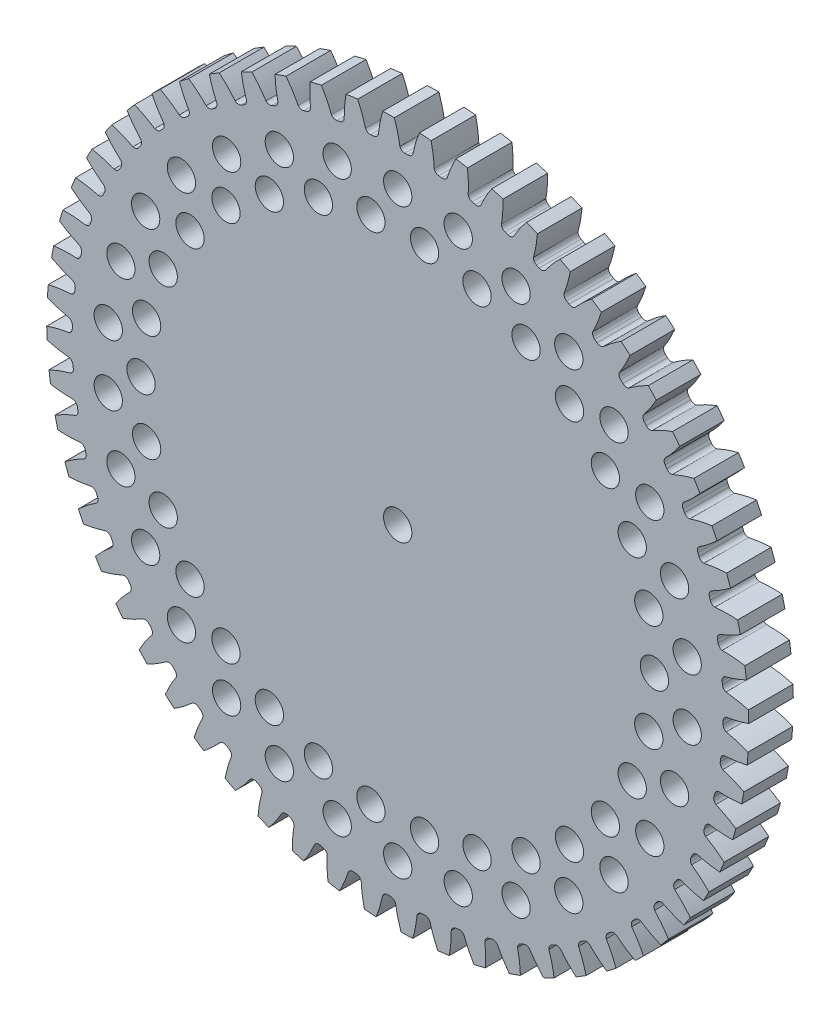
from build123d import *

# Parameters (mm, degrees)
SKETCH1_R           = 39.37
BOSS_EXTRUDE1_DEPTH = 5
CUT_EXTRUDE1_DEPTH  = 56.901643983
FILLET1_R           = 0.5984748
CIRPATTERN1_START   = -5
CIRPATTERN1_DEPTH   = 5
SKETCH5_R           = 1.5875
CUT_EXTRUDE2_DEPTH  = 56.899150665
SKETCH6_R           = 1.5875
CUT_EXTRUDE3_DEPTH  = 56.899150665


# Read off the part's stored shape, not the designer's step: CirPattern1
with BuildPart() as part:
    # Sketch1 → Boss-Extrude1 (new body)
    with BuildSketch(Plane.XY):
        Circle(SKETCH1_R)
    extrude(amount=-BOSS_EXTRUDE1_DEPTH)

    # Sketch4 → Cut-Extrude1 (cut, through all)
    with BuildSketch(Plane.XY):
        with BuildLine():
            Line((0.240086699, 36.885643751), (0.240086699, 36.511710651))
            ThreePointArc((0.240086699, 36.511710651), (0.95578806, 36.49998802), (1.671122089, 36.474237582))
            Line((1.671122089, 36.474237582), (1.690692281, 36.847658218))
            add(Edge.make_bspline(
                [(6.096951349, 44.559283342), (2.598097025, 41.225389562), (1.690692281, 36.847658218)],
                knots=[0, 0, 0, 1, 1, 1], degree=2))
            ThreePointArc((6.096951349, 44.559283342), (1.177297011, 44.959053809), (-3.756537499, 44.817306632))
            add(Edge.make_bspline(
                [(-3.756537499, 44.817306632), (-0.436961182, 41.304865544), (0.240086699, 36.885643751)],
                knots=[0, 0, 0, 1, 1, 1], degree=2))
        make_face()
    extrude(amount=-CUT_EXTRUDE1_DEPTH, mode=Mode.SUBTRACT)

    # Fillet1
    # the kernel refuses this fillet: 0.5984748 mm, written as the material it adds along each edge
    with BuildSketch(Plane(origin=(1.671122089, 36.474237582, 0), x_dir=(-0.999265847905185, 0.038311424018578885, 0), z_dir=(0, 0, -1))) as fillet1_piece_1:
        with BuildLine():
            CenterArc((0.549497284, 0.598458131), FILLET1_R, 202.038134549, 67.534227831)
            Line((-0.005249548, 0.37389625), (-0.016344485, 0.369405012))
            ThreePointArc((-0.016344485, 0.369405012), (-0.014593091, 0.186780088), (-0.011968316, -0.000168037))
            Line((-0.011968316, -0.000168037), (8.9336e-05, -0.011969163))
            ThreePointArc((8.9336e-05, -0.011969163), (0.272515249, -0.010952507), (0.544941163, -0.011969163))
            Line((0.544941163, -0.011969163), (0.545030498, 0))
        make_face()
    extrude(amount=5)
    with BuildSketch(Plane(origin=(0.240086699, 36.511710651, 0), x_dir=(0, 1, 0), z_dir=(0, 0, -1))) as fillet1_piece_2:
        with BuildLine():
            CenterArc((0.590684906, 0.557844728), FILLET1_R, 181.232024399, 67.534227831)
            Line((-0.00765154, 0.544976787), (-0.019618269, 0.544719428))
            ThreePointArc((-0.019618269, 0.544719428), (-0.014777198, 0.272334634), (-0.011969237, -7.8705e-05))
            Line((-0.011969237, -7.8705e-05), (0, -0.011969496))
            ThreePointArc((0, -0.011969496), (0.18696655, -0.011969496), (0.369598064, -0.011156895))
            Line((0.369598064, -0.011156895), (0.3739331, 0))
        make_face()
    extrude(amount=5)

    # CirPattern1 outline → CirPattern1 (cut)
    with BuildSketch(Plane.XY.offset(CIRPATTERN1_START)):
        with BuildLine():
            ThreePointArc((-1.68753641, 39.333816505), (-3.088932196, 39.248635618), (-4.486399717, 39.113541359))
            add(Edge.make_bspline(
                [(-4.486399717, 39.113541359), (-3.945469906, 37.960468416), (-3.616828179, 36.708676229)],
                knots=[0.71051755, 0.71051755, 0.71051755, 1, 1, 1], degree=2))
            ThreePointArc((-3.616828179, 36.708676229), (-3.374834584, 36.45910908), (-3.034950376, 36.386147535))
            ThreePointArc((-3.034950376, 36.386147535), (-2.864735504, 36.399944323), (-2.694457965, 36.412944848))
            ThreePointArc((-2.694457965, 36.412944848), (-2.370171981, 36.53817768), (-2.170198597, 36.822528357))
            add(Edge.make_bspline(
                [(-2.170198597, 36.822528357), (-2.041426278, 38.110319782), (-1.68753641, 39.333816505)],
                knots=[0, 0, 0, 0.28948245, 0.28948245, 0.28948245], degree=2))
        make_face()
        with BuildLine():
            add(Edge.make_bspline(
                [(5.53305958, 36.469077425), (5.926764807, 37.701954247), (6.527300605, 38.825136791)],
                knots=[0, 0, 0, 0.28948245, 0.28948245, 0.28948245], degree=2))
            ThreePointArc((6.527300605, 38.825136791), (5.138818577, 39.033183877), (3.743801398, 39.191591586))
            add(Edge.make_bspline(
                [(3.743801398, 39.191591586), (4.03317325, 37.951250423), (4.094371136, 36.658484441)],
                knots=[0.71051755, 0.71051755, 0.71051755, 1, 1, 1], degree=2))
            ThreePointArc((4.094371136, 36.658484441), (4.279188663, 36.364057636), (4.596476027, 36.222024576))
            ThreePointArc((4.596476027, 36.222024576), (4.765839809, 36.200130209), (4.935099337, 36.17744395))
            ThreePointArc((4.935099337, 36.17744395), (5.278336265, 36.232517296), (5.53305958, 36.469077425))
        make_face()
        with BuildLine():
            add(Edge.make_bspline(
                [(9.314805521, 35.690933788), (9.835224709, 36.87590338), (10.549875254, 37.930159927)],
                knots=[0, 0, 0, 0.28948245, 0.28948245, 0.28948245], degree=2))
            ThreePointArc((10.549875254, 37.930159927), (9.190746318, 38.282203202), (7.819929304, 38.585562139))
            add(Edge.make_bspline(
                [(7.819929304, 38.585562139), (7.978064991, 37.321768101), (7.903796787, 36.029687105)],
                knots=[0.71051755, 0.71051755, 0.71051755, 1, 1, 1], degree=2))
            ThreePointArc((7.903796787, 36.029687105), (8.056825882, 35.717554508), (8.357528616, 35.54313396))
            ThreePointArc((8.357528616, 35.54313396), (8.523676021, 35.503656197), (8.689636968, 35.463401777))
            ThreePointArc((8.689636968, 35.463401777), (9.03675034, 35.482295397), (9.314805521, 35.690933788))
        make_face()
        with BuildLine():
            add(Edge.make_bspline(
                [(12.994496503, 34.521752811), (13.635927831, 35.645832398), (14.456863262, 36.619612295)],
                knots=[0, 0, 0, 0.28948245, 0.28948245, 0.28948245], degree=2))
            ThreePointArc((14.456863262, 36.619612295), (13.141978319, 37.111794698), (11.810380428, 37.556781199))
            add(Edge.make_bspline(
                [(11.810380428, 37.556781199), (11.835547382, 36.283380677), (11.626626787, 35.006140977)],
                knots=[0.71051755, 0.71051755, 0.71051755, 1, 1, 1], degree=2))
            ThreePointArc((11.626626787, 35.006140977), (11.746190832, 34.679722379), (12.027014372, 34.47482533))
            ThreePointArc((12.027014372, 34.47482533), (12.188125054, 34.418196697), (12.348969117, 34.360815153))
            ThreePointArc((12.348969117, 34.360815153), (12.696155887, 34.343322045), (12.994496503, 34.521752811))
        make_face()
        with BuildLine():
            add(Edge.make_bspline(
                [(16.531817062, 32.974344287), (17.287232874, 34.025218217), (18.205458851, 34.907852526)],
                knots=[0, 0, 0, 0.28948245, 0.28948245, 0.28948245], degree=2))
            ThreePointArc((18.205458851, 34.907852526), (16.949224056, 35.534781605), (15.671434552, 36.116520305))
            add(Edge.make_bspline(
                [(15.671434552, 36.116520305), (15.563357039, 34.847464941), (15.22207303, 33.599060243)],
                knots=[0.71051755, 0.71051755, 0.71051755, 1, 1, 1], degree=2))
            ThreePointArc((15.22207303, 33.599060243), (15.306862056, 33.261931955), (15.564729642, 33.0288033))
            ThreePointArc((15.564729642, 33.0288033), (15.71903844, 32.955644233), (15.873003377, 32.881764248))
            ThreePointArc((15.873003377, 32.881764248), (16.216459693, 32.828076069), (16.531817062, 32.974344287))
        make_face()
        with BuildLine():
            add(Edge.make_bspline(
                [(19.888011574, 31.065661946), (20.749135376, 32.031816625), (21.754591623, 32.813635021)],
                knots=[0, 0, 0, 0.28948245, 0.28948245, 0.28948245], degree=2))
            ThreePointArc((21.754591623, 32.813635021), (20.570770546, 33.568442009), (19.360789159, 34.280559256))
            add(Edge.make_bspline(
                [(19.360789159, 34.280559256), (19.1206513, 33.029753087), (18.650743055, 31.823861174)],
                knots=[0.71051755, 0.71051755, 0.71051755, 1, 1, 1], degree=2))
            ThreePointArc((18.650743055, 31.823861174), (18.699828097, 31.479716843), (18.931914477, 31.220910789))
            ThreePointArc((18.931914477, 31.220910789), (19.07773075, 31.132022833), (19.22312969, 31.042453852))
            ThreePointArc((19.22312969, 31.042453852), (19.559092574, 30.953158822), (19.888011574, 31.065661946))
        make_face()
        with BuildLine():
            add(Edge.make_bspline(
                [(23.02630887, 28.816617712), (23.983706009, 29.687467747), (25.065376537, 30.359904464)],
                knots=[0, 0, 0, 0.28948245, 0.28948245, 0.28948245], degree=2))
            ThreePointArc((25.065376537, 30.359904464), (23.96693937, 31.234319537), (22.838022909, 32.069013227))
            add(Edge.make_bspline(
                [(22.838022909, 32.069013227), (22.468455704, 30.850160347), (21.875071637, 29.699993222)],
                knots=[0.71051755, 0.71051755, 0.71051755, 1, 1, 1], degree=2))
            ThreePointArc((21.875071637, 29.699993222), (21.887914908, 29.352603366), (22.091677296, 29.070955446))
            ThreePointArc((22.091677296, 29.070955446), (22.22740345, 28.967312477), (22.362643371, 28.863035836))
            ThreePointArc((22.362643371, 28.863035836), (22.687431943, 28.739112289), (23.02630887, 28.816617712))
        make_face()
        with BuildLine():
            add(Edge.make_bspline(
                [(25.912325106, 26.251852585), (26.95550614, 27.01785676), (28.101539941, 27.57354444)],
                knots=[0, 0, 0, 0.28948245, 0.28948245, 0.28948245], degree=2))
            ThreePointArc((28.101539941, 27.57354444), (27.100521391, 28.557987325), (26.065038501, 29.506112378))
            add(Edge.make_bspline(
                [(26.065038501, 29.506112378), (25.570091005, 28.332566794), (24.859732357, 27.25072593)],
                knots=[0.71051755, 0.71051755, 0.71051755, 1, 1, 1], degree=2))
            ThreePointArc((24.859732357, 27.25072593), (24.836193142, 26.903896624), (25.009399074, 26.602492631))
            ThreePointArc((25.009399074, 26.602492631), (25.133548066, 26.485230183), (25.257147252, 26.36738836))
            ThreePointArc((25.257147252, 26.36738836), (25.56720306, 26.210194029), (25.912325106, 26.251852585))
        make_face()
        with BuildLine():
            add(Edge.make_bspline(
                [(28.514440487, 23.399466666), (29.631976105, 24.05223248), (30.829816992, 24.485082893)],
                knots=[0, 0, 0, 0.28948245, 0.28948245, 0.28948245], degree=2))
            ThreePointArc((30.829816992, 24.485082893), (29.937184428, 25.568767827), (29.006480076, 26.619936387))
            add(Edge.make_bspline(
                [(29.006480076, 26.619936387), (28.391575039, 25.50455571), (27.572024646, 24.502893981)],
                knots=[0.71051755, 0.71051755, 0.71051755, 1, 1, 1], degree=2))
            ThreePointArc((27.572024646, 24.502893981), (27.512360848, 24.160425161), (27.653112643, 23.842567341))
            ThreePointArc((27.653112643, 23.842567341), (27.764324271, 23.712970165), (27.874928543, 23.582854259))
            ThreePointArc((27.874928543, 23.582854259), (28.166854551, 23.394111398), (28.514440487, 23.399466666))
        make_face()
        with BuildLine():
            add(Edge.make_bspline(
                [(30.80414569, 20.290711295), (31.983791939, 20.823086908), (33.220316116, 21.128357654)],
                knots=[0, 0, 0, 0.28948245, 0.28948245, 0.28948245], degree=2))
            ThreePointArc((33.220316116, 21.128357654), (32.445849407, 22.299411559), (31.630120586, 23.442106803))
            add(Edge.make_bspline(
                [(31.630120586, 23.442106803), (30.901995035, 22.397111377), (29.982232064, 21.486603199)],
                knots=[0.71051755, 0.71051755, 0.71051755, 1, 1, 1], degree=2))
            ThreePointArc((29.982232064, 21.486603199), (29.88709737, 21.152247024), (29.993852923, 20.821417893))
            ThreePointArc((29.993852923, 20.821417893), (30.090908728, 20.680905884), (30.187306283, 20.539941471))
            ThreePointArc((30.187306283, 20.539941471), (30.457904088, 20.321717986), (30.80414569, 20.290711295))
        make_face()
        with BuildLine():
            add(Edge.make_bspline(
                [(32.756354227, 16.959646644), (33.985186655, 17.365799239), (35.246846505, 17.540145707)],
                knots=[0, 0, 0, 0.28948245, 0.28948245, 0.28948245], degree=2))
            ThreePointArc((35.246846505, 17.540145707), (34.599030871, 18.785738271), (33.907214876, 20.007440591))
            add(Edge.make_bspline(
                [(33.907214876, 20.007440591), (33.073846306, 19.044279604), (32.063947872, 18.234900695)],
                knots=[0.71051755, 0.71051755, 0.71051755, 1, 1, 1], degree=2))
            ThreePointArc((32.063947872, 18.234900695), (31.9343846, 17.912320441), (32.005974274, 17.572144634))
            ThreePointArc((32.005974274, 17.572144634), (32.087810893, 17.42225727), (32.168945578, 17.271988787))
            ThreePointArc((32.168945578, 17.271988787), (32.415250455, 17.02667558), (32.756354227, 16.959646644))
        make_face()
        with BuildLine():
            add(Edge.make_bspline(
                [(34.349677293, 13.442768555), (35.614232554, 13.718248238), (36.887205069, 13.759760253)],
                knots=[0, 0, 0, 0.28948245, 0.28948245, 0.28948245], degree=2))
            ThreePointArc((36.887205069, 13.759760253), (36.373138113, 15.066244504), (35.812814623, 16.353568673))
            add(Edge.make_bspline(
                [(35.812814623, 16.353568673), (34.883333597, 15.482794719), (33.794364359, 14.783412804)],
                knots=[0.71051755, 0.71051755, 0.71051755, 1, 1, 1], degree=2))
            ThreePointArc((33.794364359, 14.783412804), (33.631792029, 14.476142728), (33.667431473, 14.13034728))
            ThreePointArc((33.667431473, 14.13034728), (33.733152286, 13.972726759), (33.798135174, 13.814800579))
            ThreePointArc((33.798135174, 13.814800579), (34.017448554, 13.545085353), (34.349677293, 13.442768555))
        make_face()
        with BuildLine():
            add(Edge.make_bspline(
                [(35.566658106, 9.778608681), (36.853081469, 9.92039724), (38.123419694, 9.828619987)],
                knots=[0, 0, 0, 0.28948245, 0.28948245, 0.28948245], degree=2))
            ThreePointArc((38.123419694, 9.828619987), (37.748733641, 11.181681809), (37.32604168, 12.520523635))
            add(Edge.make_bspline(
                [(37.32604168, 12.520523635), (36.310631785, 11.751677095), (35.154522717, 11.169954748)],
                knots=[0.71051755, 0.71051755, 0.71051755, 1, 1, 1], degree=2))
            ThreePointArc((35.154522717, 11.169954748), (34.960722507, 10.881361366), (34.960021247, 10.533734885))
            ThreePointArc((34.960021247, 10.533734885), (35.008906204, 10.37010813), (35.057025328, 10.206254525))
            ThreePointArc((35.057025328, 10.206254525), (35.246944369, 9.915092336), (35.566658106, 9.778608681))
        make_face()
        with BuildLine():
            add(Edge.make_bspline(
                [(36.393963169, 6.007312325), (37.688160311, 6.013856293), (38.941946155, 5.789795303)],
                knots=[0, 0, 0, 0.28948245, 0.28948245, 0.28948245], degree=2))
            ThreePointArc((38.941946155, 5.789795303), (38.710746145, 7.174610268), (38.430316813, 8.55030112))
            add(Edge.make_bspline(
                [(38.430316813, 8.55030112), (37.340103092, 7.891805638), (36.129520768, 7.434116331)],
                knots=[0.71051755, 0.71051755, 0.71051755, 1, 1, 1], degree=2))
            ThreePointArc((36.129520768, 7.434116331), (35.906615993, 7.167361532), (35.869581713, 6.821712687))
            ThreePointArc((35.869581713, 6.821712687), (35.90109522, 6.653872427), (35.931823376, 6.48588661))
            ThreePointArc((35.931823376, 6.48588661), (36.090267284, 6.176467494), (36.393963169, 6.007312325))
        make_face()
        with BuildLine():
            add(Edge.make_bspline(
                [(36.822528357, 2.170198597), (38.110319782, 2.041426278), (39.333816505, 1.68753641)],
                knots=[0, 0, 0, 0.28948245, 0.28948245, 0.28948245], degree=2))
            ThreePointArc((39.333816505, 1.68753641), (39.248635613, 3.088932196), (39.113541353, 4.486399716))
            add(Edge.make_bspline(
                [(39.113541353, 4.486399716), (37.960468416, 3.945469906), (36.708676229, 3.616828179)],
                knots=[0.71051755, 0.71051755, 0.71051755, 1, 1, 1], degree=2))
            ThreePointArc((36.708676229, 3.616828179), (36.45910908, 3.374834584), (36.386147535, 3.034950376))
            ThreePointArc((36.386147535, 3.034950376), (36.399944323, 2.864735504), (36.412944848, 2.694457965))
            ThreePointArc((36.412944848, 2.694457965), (36.53817768, 2.370171981), (36.822528357, 2.170198597))
        make_face()
        with BuildLine():
            add(Edge.make_bspline(
                [(36.847658218, -1.690692281), (38.114934615, -1.95337003), (39.29473733, -2.433211484)],
                knots=[0, 0, 0, 0.28948245, 0.28948245, 0.28948245], degree=2))
            ThreePointArc((39.29473733, -2.433211484), (39.356508816, -1.030588864), (39.368229749, 0.373344379))
            add(Edge.make_bspline(
                [(39.368229749, 0.373344379), (38.164930905, -0.044093219), (36.885643751, -0.240086699)],
                knots=[0.71051755, 0.71051755, 0.71051755, 1, 1, 1], degree=2))
            ThreePointArc((36.885643751, -0.240086699), (36.612148538, -0.454667757), (36.504059111, -0.785063485))
            ThreePointArc((36.504059111, -0.785063485), (36.49998802, -0.95578806), (36.495118477, -1.126491726))
            ThreePointArc((36.495118477, -1.126491726), (36.585768154, -1.462091633), (36.847658218, -1.690692281))
        make_face()
        with BuildLine():
            add(Edge.make_bspline(
                [(36.469077425, -5.53305958), (37.701954247, -5.926764807), (38.825136791, -6.527300605)],
                knots=[0, 0, 0, 0.28948245, 0.28948245, 0.28948245], degree=2))
            ThreePointArc((38.825136791, -6.527300605), (39.033183872, -5.138818577), (39.191591581, -3.743801398))
            add(Edge.make_bspline(
                [(39.191591581, -3.743801398), (37.951250423, -4.03317325), (36.658484441, -4.094371136)],
                knots=[0.71051755, 0.71051755, 0.71051755, 1, 1, 1], degree=2))
            ThreePointArc((36.658484441, -4.094371136), (36.364057636, -4.279188663), (36.222024576, -4.596476027))
            ThreePointArc((36.222024576, -4.596476027), (36.200130209, -4.765839809), (36.17744395, -4.935099337))
            ThreePointArc((36.17744395, -4.935099337), (36.232517296, -5.278336265), (36.469077425, -5.53305958))
        make_face()
        with BuildLine():
            add(Edge.make_bspline(
                [(35.690933788, -9.314805521), (36.87590338, -9.835224709), (37.930159927, -10.549875254)],
                knots=[0, 0, 0, 0.28948245, 0.28948245, 0.28948245], degree=2))
            ThreePointArc((37.930159927, -10.549875254), (38.282203198, -9.190746317), (38.585562135, -7.819929303))
            add(Edge.make_bspline(
                [(38.585562135, -7.819929303), (37.321768101, -7.978064991), (36.029687105, -7.903796787)],
                knots=[0.71051755, 0.71051755, 0.71051755, 1, 1, 1], degree=2))
            ThreePointArc((36.029687105, -7.903796787), (35.717554508, -8.056825882), (35.54313396, -8.357528616))
            ThreePointArc((35.54313396, -8.357528616), (35.503656197, -8.523676021), (35.463401777, -8.689636968))
            ThreePointArc((35.463401777, -8.689636968), (35.482295397, -9.03675034), (35.690933788, -9.314805521))
        make_face()
        with BuildLine():
            add(Edge.make_bspline(
                [(34.521752811, -12.994496503), (35.645832398, -13.635927831), (36.619612295, -14.456863262)],
                knots=[0, 0, 0, 0.28948245, 0.28948245, 0.28948245], degree=2))
            ThreePointArc((36.619612295, -14.456863262), (37.111794695, -13.141978318), (37.556781195, -11.810380427))
            add(Edge.make_bspline(
                [(37.556781195, -11.810380427), (36.283380677, -11.835547382), (35.006140977, -11.626626787)],
                knots=[0.71051755, 0.71051755, 0.71051755, 1, 1, 1], degree=2))
            ThreePointArc((35.006140977, -11.626626787), (34.679722379, -11.746190832), (34.47482533, -12.027014372))
            ThreePointArc((34.47482533, -12.027014372), (34.418196697, -12.188125054), (34.360815153, -12.348969117))
            ThreePointArc((34.360815153, -12.348969117), (34.343322045, -12.696155887), (34.521752811, -12.994496503))
        make_face()
        with BuildLine():
            add(Edge.make_bspline(
                [(32.974344287, -16.531817062), (34.025218217, -17.287232874), (34.907852526, -18.205458851)],
                knots=[0, 0, 0, 0.28948245, 0.28948245, 0.28948245], degree=2))
            ThreePointArc((34.907852526, -18.205458851), (35.534781603, -16.949224055), (36.116520302, -15.671434551))
            add(Edge.make_bspline(
                [(36.116520302, -15.671434551), (34.847464941, -15.563357039), (33.599060243, -15.22207303)],
                knots=[0.71051755, 0.71051755, 0.71051755, 1, 1, 1], degree=2))
            ThreePointArc((33.599060243, -15.22207303), (33.261931955, -15.306862056), (33.0288033, -15.564729642))
            ThreePointArc((33.0288033, -15.564729642), (32.955644233, -15.71903844), (32.881764248, -15.873003377))
            ThreePointArc((32.881764248, -15.873003377), (32.828076069, -16.216459693), (32.974344287, -16.531817062))
        make_face()
        with BuildLine():
            add(Edge.make_bspline(
                [(31.065661946, -19.888011574), (32.031816625, -20.749135376), (32.813635021, -21.754591623)],
                knots=[0, 0, 0, 0.28948245, 0.28948245, 0.28948245], degree=2))
            ThreePointArc((32.813635021, -21.754591623), (33.568442007, -20.570770545), (34.280559254, -19.360789158))
            add(Edge.make_bspline(
                [(34.280559254, -19.360789158), (33.029753087, -19.1206513), (31.823861174, -18.650743055)],
                knots=[0.71051755, 0.71051755, 0.71051755, 1, 1, 1], degree=2))
            ThreePointArc((31.823861174, -18.650743055), (31.479716843, -18.699828097), (31.220910789, -18.931914477))
            ThreePointArc((31.220910789, -18.931914477), (31.132022833, -19.07773075), (31.042453852, -19.22312969))
            ThreePointArc((31.042453852, -19.22312969), (30.953158822, -19.559092574), (31.065661946, -19.888011574))
        make_face()
        with BuildLine():
            add(Edge.make_bspline(
                [(28.816617712, -23.02630887), (29.687467747, -23.983706009), (30.359904464, -25.065376537)],
                knots=[0, 0, 0, 0.28948245, 0.28948245, 0.28948245], degree=2))
            ThreePointArc((30.359904464, -25.065376537), (31.234319536, -23.96693937), (32.069013226, -22.838022908))
            add(Edge.make_bspline(
                [(32.069013226, -22.838022908), (30.850160347, -22.468455704), (29.699993222, -21.875071637)],
                knots=[0.71051755, 0.71051755, 0.71051755, 1, 1, 1], degree=2))
            ThreePointArc((29.699993222, -21.875071637), (29.352603366, -21.887914908), (29.070955446, -22.091677296))
            ThreePointArc((29.070955446, -22.091677296), (28.967312477, -22.22740345), (28.863035836, -22.362643371))
            ThreePointArc((28.863035836, -22.362643371), (28.739112289, -22.687431943), (28.816617712, -23.02630887))
        make_face()
        with BuildLine():
            add(Edge.make_bspline(
                [(26.251852585, -25.912325106), (27.01785676, -26.95550614), (27.57354444, -28.101539941)],
                knots=[0, 0, 0, 0.28948245, 0.28948245, 0.28948245], degree=2))
            ThreePointArc((27.57354444, -28.101539941), (28.557987325, -27.100521391), (29.506112377, -26.065038501))
            add(Edge.make_bspline(
                [(29.506112377, -26.065038501), (28.332566794, -25.570091005), (27.25072593, -24.859732357)],
                knots=[0.71051755, 0.71051755, 0.71051755, 1, 1, 1], degree=2))
            ThreePointArc((27.25072593, -24.859732357), (26.903896624, -24.836193142), (26.602492631, -25.009399074))
            ThreePointArc((26.602492631, -25.009399074), (26.485230183, -25.133548066), (26.36738836, -25.257147252))
            ThreePointArc((26.36738836, -25.257147252), (26.210194029, -25.56720306), (26.251852585, -25.912325106))
        make_face()
        with BuildLine():
            add(Edge.make_bspline(
                [(23.399466666, -28.514440487), (24.05223248, -29.631976105), (24.485082893, -30.829816992)],
                knots=[0, 0, 0, 0.28948245, 0.28948245, 0.28948245], degree=2))
            ThreePointArc((24.485082893, -30.829816992), (25.568767828, -29.937184428), (26.619936387, -29.006480077))
            add(Edge.make_bspline(
                [(26.619936387, -29.006480077), (25.50455571, -28.391575039), (24.502893981, -27.572024646)],
                knots=[0.71051755, 0.71051755, 0.71051755, 1, 1, 1], degree=2))
            ThreePointArc((24.502893981, -27.572024646), (24.160425161, -27.512360848), (23.842567341, -27.653112643))
            ThreePointArc((23.842567341, -27.653112643), (23.712970165, -27.764324271), (23.582854259, -27.874928543))
            ThreePointArc((23.582854259, -27.874928543), (23.394111398, -28.166854551), (23.399466666, -28.514440487))
        make_face()
        with BuildLine():
            add(Edge.make_bspline(
                [(20.290711295, -30.80414569), (20.823086908, -31.983791939), (21.128357654, -33.220316116)],
                knots=[0, 0, 0, 0.28948245, 0.28948245, 0.28948245], degree=2))
            ThreePointArc((21.128357654, -33.220316116), (22.29941156, -32.445849409), (23.442106804, -31.630120587))
            add(Edge.make_bspline(
                [(23.442106804, -31.630120587), (22.397111377, -30.901995035), (21.486603199, -29.982232064)],
                knots=[0.71051755, 0.71051755, 0.71051755, 1, 1, 1], degree=2))
            ThreePointArc((21.486603199, -29.982232064), (21.152247024, -29.88709737), (20.821417893, -29.993852923))
            ThreePointArc((20.821417893, -29.993852923), (20.680905884, -30.090908728), (20.539941471, -30.187306283))
            ThreePointArc((20.539941471, -30.187306283), (20.321717986, -30.457904088), (20.290711295, -30.80414569))
        make_face()
        with BuildLine():
            add(Edge.make_bspline(
                [(16.959646644, -32.756354227), (17.365799239, -33.985186655), (17.540145707, -35.246846505)],
                knots=[0, 0, 0, 0.28948245, 0.28948245, 0.28948245], degree=2))
            ThreePointArc((17.540145707, -35.246846505), (18.785738272, -34.599030873), (20.007440592, -33.907214877))
            add(Edge.make_bspline(
                [(20.007440592, -33.907214877), (19.044279604, -33.073846306), (18.234900695, -32.063947872)],
                knots=[0.71051755, 0.71051755, 0.71051755, 1, 1, 1], degree=2))
            ThreePointArc((18.234900695, -32.063947872), (17.912320441, -31.9343846), (17.572144634, -32.005974274))
            ThreePointArc((17.572144634, -32.005974274), (17.42225727, -32.087810893), (17.271988787, -32.168945578))
            ThreePointArc((17.271988787, -32.168945578), (17.02667558, -32.415250455), (16.959646644, -32.756354227))
        make_face()
        with BuildLine():
            add(Edge.make_bspline(
                [(13.442768555, -34.349677293), (13.718248238, -35.614232554), (13.759760253, -36.887205069)],
                knots=[0, 0, 0, 0.28948245, 0.28948245, 0.28948245], degree=2))
            ThreePointArc((13.759760253, -36.887205069), (15.066244505, -36.373138115), (16.353568674, -35.812814626))
            add(Edge.make_bspline(
                [(16.353568674, -35.812814626), (15.482794719, -34.883333597), (14.783412804, -33.794364359)],
                knots=[0.71051755, 0.71051755, 0.71051755, 1, 1, 1], degree=2))
            ThreePointArc((14.783412804, -33.794364359), (14.476142728, -33.631792029), (14.13034728, -33.667431473))
            ThreePointArc((14.13034728, -33.667431473), (13.972726759, -33.733152286), (13.814800579, -33.798135174))
            ThreePointArc((13.814800579, -33.798135174), (13.545085353, -34.017448554), (13.442768555, -34.349677293))
        make_face()
        with BuildLine():
            add(Edge.make_bspline(
                [(9.778608681, -35.566658106), (9.92039724, -36.853081469), (9.828619987, -38.123419694)],
                knots=[0, 0, 0, 0.28948245, 0.28948245, 0.28948245], degree=2))
            ThreePointArc((9.828619987, -38.123419694), (11.181681809, -37.748733645), (12.520523636, -37.326041683))
            add(Edge.make_bspline(
                [(12.520523636, -37.326041683), (11.751677095, -36.310631785), (11.169954748, -35.154522717)],
                knots=[0.71051755, 0.71051755, 0.71051755, 1, 1, 1], degree=2))
            ThreePointArc((11.169954748, -35.154522717), (10.881361366, -34.960722507), (10.533734885, -34.960021247))
            ThreePointArc((10.533734885, -34.960021247), (10.37010813, -35.008906204), (10.206254525, -35.057025328))
            ThreePointArc((10.206254525, -35.057025328), (9.915092336, -35.246944369), (9.778608681, -35.566658106))
        make_face()
        with BuildLine():
            add(Edge.make_bspline(
                [(6.007312325, -36.393963169), (6.013856293, -37.688160311), (5.789795303, -38.941946155)],
                knots=[0, 0, 0, 0.28948245, 0.28948245, 0.28948245], degree=2))
            ThreePointArc((5.789795303, -38.941946155), (7.174610269, -38.710746149), (8.550301121, -38.430316817))
            add(Edge.make_bspline(
                [(8.550301121, -38.430316817), (7.891805638, -37.340103092), (7.434116331, -36.129520768)],
                knots=[0.71051755, 0.71051755, 0.71051755, 1, 1, 1], degree=2))
            ThreePointArc((7.434116331, -36.129520768), (7.167361532, -35.906615993), (6.821712687, -35.869581713))
            ThreePointArc((6.821712687, -35.869581713), (6.653872427, -35.90109522), (6.48588661, -35.931823376))
            ThreePointArc((6.48588661, -35.931823376), (6.176467494, -36.090267284), (6.007312325, -36.393963169))
        make_face()
        with BuildLine():
            add(Edge.make_bspline(
                [(2.170198597, -36.822528357), (2.041426278, -38.110319782), (1.68753641, -39.333816505)],
                knots=[0, 0, 0, 0.28948245, 0.28948245, 0.28948245], degree=2))
            ThreePointArc((1.68753641, -39.333816505), (3.088932196, -39.248635617), (4.486399717, -39.113541357))
            add(Edge.make_bspline(
                [(4.486399717, -39.113541357), (3.945469906, -37.960468416), (3.616828179, -36.708676229)],
                knots=[0.71051755, 0.71051755, 0.71051755, 1, 1, 1], degree=2))
            ThreePointArc((3.616828179, -36.708676229), (3.374834584, -36.45910908), (3.034950376, -36.386147535))
            ThreePointArc((3.034950376, -36.386147535), (2.864735504, -36.399944323), (2.694457965, -36.412944848))
            ThreePointArc((2.694457965, -36.412944848), (2.370171981, -36.53817768), (2.170198597, -36.822528357))
        make_face()
        with BuildLine():
            add(Edge.make_bspline(
                [(-1.690692281, -36.847658218), (-1.95337003, -38.114934615), (-2.433211484, -39.29473733)],
                knots=[0, 0, 0, 0.28948245, 0.28948245, 0.28948245], degree=2))
            ThreePointArc((-2.433211484, -39.29473733), (-1.030588864, -39.356508821), (0.373344379, -39.368229754))
            add(Edge.make_bspline(
                [(0.373344379, -39.368229754), (-0.044093219, -38.164930905), (-0.240086699, -36.885643751)],
                knots=[0.71051755, 0.71051755, 0.71051755, 1, 1, 1], degree=2))
            ThreePointArc((-0.240086699, -36.885643751), (-0.454667757, -36.612148538), (-0.785063485, -36.504059111))
            ThreePointArc((-0.785063485, -36.504059111), (-0.95578806, -36.49998802), (-1.126491726, -36.495118477))
            ThreePointArc((-1.126491726, -36.495118477), (-1.462091633, -36.585768154), (-1.690692281, -36.847658218))
        make_face()
        with BuildLine():
            add(Edge.make_bspline(
                [(-5.53305958, -36.469077425), (-5.926764807, -37.701954247), (-6.527300605, -38.825136791)],
                knots=[0, 0, 0, 0.28948245, 0.28948245, 0.28948245], degree=2))
            ThreePointArc((-6.527300605, -38.825136791), (-5.138818577, -39.033183878), (-3.743801399, -39.191591587))
            add(Edge.make_bspline(
                [(-3.743801399, -39.191591587), (-4.03317325, -37.951250423), (-4.094371136, -36.658484441)],
                knots=[0.71051755, 0.71051755, 0.71051755, 1, 1, 1], degree=2))
            ThreePointArc((-4.094371136, -36.658484441), (-4.279188663, -36.364057636), (-4.596476027, -36.222024576))
            ThreePointArc((-4.596476027, -36.222024576), (-4.765839809, -36.200130209), (-4.935099337, -36.17744395))
            ThreePointArc((-4.935099337, -36.17744395), (-5.278336265, -36.232517296), (-5.53305958, -36.469077425))
        make_face()
        with BuildLine():
            add(Edge.make_bspline(
                [(-9.314805521, -35.690933788), (-9.835224709, -36.87590338), (-10.549875254, -37.930159927)],
                knots=[0, 0, 0, 0.28948245, 0.28948245, 0.28948245], degree=2))
            ThreePointArc((-10.549875254, -37.930159927), (-9.190746319, -38.282203204), (-7.819929304, -38.585562141))
            add(Edge.make_bspline(
                [(-7.819929304, -38.585562141), (-7.978064991, -37.321768101), (-7.903796787, -36.029687105)],
                knots=[0.71051755, 0.71051755, 0.71051755, 1, 1, 1], degree=2))
            ThreePointArc((-7.903796787, -36.029687105), (-8.056825882, -35.717554508), (-8.357528616, -35.54313396))
            ThreePointArc((-8.357528616, -35.54313396), (-8.523676021, -35.503656197), (-8.689636968, -35.463401777))
            ThreePointArc((-8.689636968, -35.463401777), (-9.03675034, -35.482295397), (-9.314805521, -35.690933788))
        make_face()
        with BuildLine():
            add(Edge.make_bspline(
                [(-12.994496503, -34.521752811), (-13.635927831, -35.645832398), (-14.456863262, -36.619612295)],
                knots=[0, 0, 0, 0.28948245, 0.28948245, 0.28948245], degree=2))
            ThreePointArc((-14.456863262, -36.619612295), (-13.14197832, -37.111794701), (-11.810380429, -37.556781202))
            add(Edge.make_bspline(
                [(-11.810380429, -37.556781202), (-11.835547382, -36.283380677), (-11.626626787, -35.006140977)],
                knots=[0.71051755, 0.71051755, 0.71051755, 1, 1, 1], degree=2))
            ThreePointArc((-11.626626787, -35.006140977), (-11.746190832, -34.679722379), (-12.027014372, -34.47482533))
            ThreePointArc((-12.027014372, -34.47482533), (-12.188125054, -34.418196697), (-12.348969117, -34.360815153))
            ThreePointArc((-12.348969117, -34.360815153), (-12.696155887, -34.343322045), (-12.994496503, -34.521752811))
        make_face()
        with BuildLine():
            add(Edge.make_bspline(
                [(-16.531817062, -32.974344287), (-17.287232874, -34.025218217), (-18.205458851, -34.907852526)],
                knots=[0, 0, 0, 0.28948245, 0.28948245, 0.28948245], degree=2))
            ThreePointArc((-18.205458851, -34.907852526), (-16.949224058, -35.534781609), (-15.671434553, -36.116520308))
            add(Edge.make_bspline(
                [(-15.671434553, -36.116520308), (-15.563357039, -34.847464941), (-15.22207303, -33.599060243)],
                knots=[0.71051755, 0.71051755, 0.71051755, 1, 1, 1], degree=2))
            ThreePointArc((-15.22207303, -33.599060243), (-15.306862056, -33.261931955), (-15.564729642, -33.0288033))
            ThreePointArc((-15.564729642, -33.0288033), (-15.71903844, -32.955644233), (-15.873003377, -32.881764248))
            ThreePointArc((-15.873003377, -32.881764248), (-16.216459693, -32.828076069), (-16.531817062, -32.974344287))
        make_face()
        with BuildLine():
            add(Edge.make_bspline(
                [(-19.888011574, -31.065661946), (-20.749135376, -32.031816625), (-21.754591623, -32.813635021)],
                knots=[0, 0, 0, 0.28948245, 0.28948245, 0.28948245], degree=2))
            ThreePointArc((-21.754591623, -32.813635021), (-20.570770549, -33.568442013), (-19.360789162, -34.28055926))
            add(Edge.make_bspline(
                [(-19.360789162, -34.28055926), (-19.1206513, -33.029753087), (-18.650743055, -31.823861174)],
                knots=[0.71051755, 0.71051755, 0.71051755, 1, 1, 1], degree=2))
            ThreePointArc((-18.650743055, -31.823861174), (-18.699828097, -31.479716843), (-18.931914477, -31.220910789))
            ThreePointArc((-18.931914477, -31.220910789), (-19.07773075, -31.132022833), (-19.22312969, -31.042453852))
            ThreePointArc((-19.22312969, -31.042453852), (-19.559092574, -30.953158822), (-19.888011574, -31.065661946))
        make_face()
        with BuildLine():
            add(Edge.make_bspline(
                [(-23.02630887, -28.816617712), (-23.983706009, -29.687467747), (-25.065376537, -30.359904464)],
                knots=[0, 0, 0, 0.28948245, 0.28948245, 0.28948245], degree=2))
            ThreePointArc((-25.065376537, -30.359904464), (-23.966939374, -31.234319542), (-22.838022913, -32.069013232))
            add(Edge.make_bspline(
                [(-22.838022913, -32.069013232), (-22.468455704, -30.850160347), (-21.875071637, -29.699993222)],
                knots=[0.71051755, 0.71051755, 0.71051755, 1, 1, 1], degree=2))
            ThreePointArc((-21.875071637, -29.699993222), (-21.887914908, -29.352603366), (-22.091677296, -29.070955446))
            ThreePointArc((-22.091677296, -29.070955446), (-22.22740345, -28.967312477), (-22.362643371, -28.863035836))
            ThreePointArc((-22.362643371, -28.863035836), (-22.687431943, -28.739112289), (-23.02630887, -28.816617712))
        make_face()
        with BuildLine():
            add(Edge.make_bspline(
                [(-25.912325106, -26.251852585), (-26.95550614, -27.01785676), (-28.101539941, -27.57354444)],
                knots=[0, 0, 0, 0.28948245, 0.28948245, 0.28948245], degree=2))
            ThreePointArc((-28.101539941, -27.57354444), (-27.100521396, -28.55798733), (-26.065038505, -29.506112383))
            add(Edge.make_bspline(
                [(-26.065038505, -29.506112383), (-25.570091005, -28.332566794), (-24.859732357, -27.25072593)],
                knots=[0.71051755, 0.71051755, 0.71051755, 1, 1, 1], degree=2))
            ThreePointArc((-24.859732357, -27.25072593), (-24.836193142, -26.903896624), (-25.009399074, -26.602492631))
            ThreePointArc((-25.009399074, -26.602492631), (-25.133548066, -26.485230183), (-25.257147252, -26.36738836))
            ThreePointArc((-25.257147252, -26.36738836), (-25.56720306, -26.210194029), (-25.912325106, -26.251852585))
        make_face()
        with BuildLine():
            add(Edge.make_bspline(
                [(-28.514440487, -23.399466666), (-29.631976105, -24.05223248), (-30.829816992, -24.485082893)],
                knots=[0, 0, 0, 0.28948245, 0.28948245, 0.28948245], degree=2))
            ThreePointArc((-30.829816992, -24.485082893), (-29.937184434, -25.568767832), (-29.006480082, -26.619936392))
            add(Edge.make_bspline(
                [(-29.006480082, -26.619936392), (-28.391575039, -25.50455571), (-27.572024646, -24.502893981)],
                knots=[0.71051755, 0.71051755, 0.71051755, 1, 1, 1], degree=2))
            ThreePointArc((-27.572024646, -24.502893981), (-27.512360848, -24.160425161), (-27.653112643, -23.842567341))
            ThreePointArc((-27.653112643, -23.842567341), (-27.764324271, -23.712970165), (-27.874928543, -23.582854259))
            ThreePointArc((-27.874928543, -23.582854259), (-28.166854551, -23.394111398), (-28.514440487, -23.399466666))
        make_face()
        with BuildLine():
            add(Edge.make_bspline(
                [(-30.80414569, -20.290711295), (-31.983791939, -20.823086908), (-33.220316116, -21.128357654)],
                knots=[0, 0, 0, 0.28948245, 0.28948245, 0.28948245], degree=2))
            ThreePointArc((-33.220316116, -21.128357654), (-32.445849415, -22.299411564), (-31.630120593, -23.442106808))
            add(Edge.make_bspline(
                [(-31.630120593, -23.442106808), (-30.901995035, -22.397111377), (-29.982232064, -21.486603199)],
                knots=[0.71051755, 0.71051755, 0.71051755, 1, 1, 1], degree=2))
            ThreePointArc((-29.982232064, -21.486603199), (-29.88709737, -21.152247024), (-29.993852923, -20.821417893))
            ThreePointArc((-29.993852923, -20.821417893), (-30.090908728, -20.680905884), (-30.187306283, -20.539941471))
            ThreePointArc((-30.187306283, -20.539941471), (-30.457904088, -20.321717986), (-30.80414569, -20.290711295))
        make_face()
        with BuildLine():
            add(Edge.make_bspline(
                [(-32.756354227, -16.959646644), (-33.985186655, -17.365799239), (-35.246846505, -17.540145707)],
                knots=[0, 0, 0, 0.28948245, 0.28948245, 0.28948245], degree=2))
            ThreePointArc((-35.246846505, -17.540145707), (-34.599030879, -18.785738275), (-33.907214883, -20.007440596))
            add(Edge.make_bspline(
                [(-33.907214883, -20.007440596), (-33.073846306, -19.044279604), (-32.063947872, -18.234900695)],
                knots=[0.71051755, 0.71051755, 0.71051755, 1, 1, 1], degree=2))
            ThreePointArc((-32.063947872, -18.234900695), (-31.9343846, -17.912320441), (-32.005974274, -17.572144634))
            ThreePointArc((-32.005974274, -17.572144634), (-32.087810893, -17.42225727), (-32.168945578, -17.271988787))
            ThreePointArc((-32.168945578, -17.271988787), (-32.415250455, -17.02667558), (-32.756354227, -16.959646644))
        make_face()
        with BuildLine():
            add(Edge.make_bspline(
                [(-34.349677293, -13.442768555), (-35.614232554, -13.718248238), (-36.887205069, -13.759760253)],
                knots=[0, 0, 0, 0.28948245, 0.28948245, 0.28948245], degree=2))
            ThreePointArc((-36.887205069, -13.759760253), (-36.373138122, -15.066244507), (-35.812814632, -16.353568677))
            add(Edge.make_bspline(
                [(-35.812814632, -16.353568677), (-34.883333597, -15.482794719), (-33.794364359, -14.783412804)],
                knots=[0.71051755, 0.71051755, 0.71051755, 1, 1, 1], degree=2))
            ThreePointArc((-33.794364359, -14.783412804), (-33.631792029, -14.476142728), (-33.667431473, -14.13034728))
            ThreePointArc((-33.667431473, -14.13034728), (-33.733152286, -13.972726759), (-33.798135174, -13.814800579))
            ThreePointArc((-33.798135174, -13.814800579), (-34.017448554, -13.545085353), (-34.349677293, -13.442768555))
        make_face()
        with BuildLine():
            add(Edge.make_bspline(
                [(-35.566658106, -9.778608681), (-36.853081469, -9.92039724), (-38.123419694, -9.828619987)],
                knots=[0, 0, 0, 0.28948245, 0.28948245, 0.28948245], degree=2))
            ThreePointArc((-38.123419694, -9.828619987), (-37.748733651, -11.181681811), (-37.326041689, -12.520523638))
            add(Edge.make_bspline(
                [(-37.326041689, -12.520523638), (-36.310631785, -11.751677095), (-35.154522717, -11.169954748)],
                knots=[0.71051755, 0.71051755, 0.71051755, 1, 1, 1], degree=2))
            ThreePointArc((-35.154522717, -11.169954748), (-34.960722507, -10.881361366), (-34.960021247, -10.533734885))
            ThreePointArc((-34.960021247, -10.533734885), (-35.008906204, -10.37010813), (-35.057025328, -10.206254525))
            ThreePointArc((-35.057025328, -10.206254525), (-35.246944369, -9.915092336), (-35.566658106, -9.778608681))
        make_face()
        with BuildLine():
            add(Edge.make_bspline(
                [(-36.393963169, -6.007312325), (-37.688160311, -6.013856293), (-38.941946155, -5.789795303)],
                knots=[0, 0, 0, 0.28948245, 0.28948245, 0.28948245], degree=2))
            ThreePointArc((-38.941946155, -5.789795303), (-38.710746155, -7.17461027), (-38.430316823, -8.550301122))
            add(Edge.make_bspline(
                [(-38.430316823, -8.550301122), (-37.340103092, -7.891805638), (-36.129520768, -7.434116331)],
                knots=[0.71051755, 0.71051755, 0.71051755, 1, 1, 1], degree=2))
            ThreePointArc((-36.129520768, -7.434116331), (-35.906615993, -7.167361532), (-35.869581713, -6.821712687))
            ThreePointArc((-35.869581713, -6.821712687), (-35.90109522, -6.653872427), (-35.931823376, -6.48588661))
            ThreePointArc((-35.931823376, -6.48588661), (-36.090267284, -6.176467494), (-36.393963169, -6.007312325))
        make_face()
        with BuildLine():
            add(Edge.make_bspline(
                [(-36.822528357, -2.170198597), (-38.110319782, -2.041426278), (-39.333816505, -1.68753641)],
                knots=[0, 0, 0, 0.28948245, 0.28948245, 0.28948245], degree=2))
            ThreePointArc((-39.333816505, -1.68753641), (-39.248635623, -3.088932196), (-39.113541363, -4.486399718))
            add(Edge.make_bspline(
                [(-39.113541363, -4.486399718), (-37.960468416, -3.945469906), (-36.708676229, -3.616828179)],
                knots=[0.71051755, 0.71051755, 0.71051755, 1, 1, 1], degree=2))
            ThreePointArc((-36.708676229, -3.616828179), (-36.45910908, -3.374834584), (-36.386147535, -3.034950376))
            ThreePointArc((-36.386147535, -3.034950376), (-36.399944323, -2.864735504), (-36.412944848, -2.694457965))
            ThreePointArc((-36.412944848, -2.694457965), (-36.53817768, -2.370171981), (-36.822528357, -2.170198597))
        make_face()
        with BuildLine():
            add(Edge.make_bspline(
                [(-36.847658218, 1.690692281), (-38.114934615, 1.95337003), (-39.29473733, 2.433211484)],
                knots=[0, 0, 0, 0.28948245, 0.28948245, 0.28948245], degree=2))
            ThreePointArc((-39.29473733, 2.433211484), (-39.356508826, 1.030588864), (-39.368229759, -0.373344379))
            add(Edge.make_bspline(
                [(-39.368229759, -0.373344379), (-38.164930905, 0.044093219), (-36.885643751, 0.240086699)],
                knots=[0.71051755, 0.71051755, 0.71051755, 1, 1, 1], degree=2))
            ThreePointArc((-36.885643751, 0.240086699), (-36.612148538, 0.454667757), (-36.504059111, 0.785063485))
            ThreePointArc((-36.504059111, 0.785063485), (-36.49998802, 0.95578806), (-36.495118477, 1.126491726))
            ThreePointArc((-36.495118477, 1.126491726), (-36.585768154, 1.462091633), (-36.847658218, 1.690692281))
        make_face()
        with BuildLine():
            add(Edge.make_bspline(
                [(-36.469077425, 5.53305958), (-37.701954247, 5.926764807), (-38.825136791, 6.527300605)],
                knots=[0, 0, 0, 0.28948245, 0.28948245, 0.28948245], degree=2))
            ThreePointArc((-38.825136791, 6.527300605), (-39.033183883, 5.138818578), (-39.191591592, 3.743801399))
            add(Edge.make_bspline(
                [(-39.191591592, 3.743801399), (-37.951250423, 4.03317325), (-36.658484441, 4.094371136)],
                knots=[0.71051755, 0.71051755, 0.71051755, 1, 1, 1], degree=2))
            ThreePointArc((-36.658484441, 4.094371136), (-36.364057636, 4.279188663), (-36.222024576, 4.596476027))
            ThreePointArc((-36.222024576, 4.596476027), (-36.200130209, 4.765839809), (-36.17744395, 4.935099337))
            ThreePointArc((-36.17744395, 4.935099337), (-36.232517296, 5.278336265), (-36.469077425, 5.53305958))
        make_face()
        with BuildLine():
            add(Edge.make_bspline(
                [(-35.690933788, 9.314805521), (-36.87590338, 9.835224709), (-37.930159927, 10.549875254)],
                knots=[0, 0, 0, 0.28948245, 0.28948245, 0.28948245], degree=2))
            ThreePointArc((-37.930159927, 10.549875254), (-38.282203208, 9.19074632), (-38.585562145, 7.819929305))
            add(Edge.make_bspline(
                [(-38.585562145, 7.819929305), (-37.321768101, 7.978064991), (-36.029687105, 7.903796787)],
                knots=[0.71051755, 0.71051755, 0.71051755, 1, 1, 1], degree=2))
            ThreePointArc((-36.029687105, 7.903796787), (-35.717554508, 8.056825882), (-35.54313396, 8.357528616))
            ThreePointArc((-35.54313396, 8.357528616), (-35.503656197, 8.523676021), (-35.463401777, 8.689636968))
            ThreePointArc((-35.463401777, 8.689636968), (-35.482295397, 9.03675034), (-35.690933788, 9.314805521))
        make_face()
        with BuildLine():
            add(Edge.make_bspline(
                [(-34.521752811, 12.994496503), (-35.645832398, 13.635927831), (-36.619612295, 14.456863262)],
                knots=[0, 0, 0, 0.28948245, 0.28948245, 0.28948245], degree=2))
            ThreePointArc((-36.619612295, 14.456863262), (-37.111794704, 13.141978322), (-37.556781205, 11.81038043))
            add(Edge.make_bspline(
                [(-37.556781205, 11.81038043), (-36.283380677, 11.835547382), (-35.006140977, 11.626626787)],
                knots=[0.71051755, 0.71051755, 0.71051755, 1, 1, 1], degree=2))
            ThreePointArc((-35.006140977, 11.626626787), (-34.679722379, 11.746190832), (-34.47482533, 12.027014372))
            ThreePointArc((-34.47482533, 12.027014372), (-34.418196697, 12.188125054), (-34.360815153, 12.348969117))
            ThreePointArc((-34.360815153, 12.348969117), (-34.343322045, 12.696155887), (-34.521752811, 12.994496503))
        make_face()
        with BuildLine():
            add(Edge.make_bspline(
                [(-32.974344287, 16.531817062), (-34.025218217, 17.287232874), (-34.907852526, 18.205458851)],
                knots=[0, 0, 0, 0.28948245, 0.28948245, 0.28948245], degree=2))
            ThreePointArc((-34.907852526, 18.205458851), (-35.534781611, 16.949224059), (-36.116520311, 15.671434554))
            add(Edge.make_bspline(
                [(-36.116520311, 15.671434554), (-34.847464941, 15.563357039), (-33.599060243, 15.22207303)],
                knots=[0.71051755, 0.71051755, 0.71051755, 1, 1, 1], degree=2))
            ThreePointArc((-33.599060243, 15.22207303), (-33.261931955, 15.306862056), (-33.0288033, 15.564729642))
            ThreePointArc((-33.0288033, 15.564729642), (-32.955644233, 15.71903844), (-32.881764248, 15.873003377))
            ThreePointArc((-32.881764248, 15.873003377), (-32.828076069, 16.216459693), (-32.974344287, 16.531817062))
        make_face()
        with BuildLine():
            add(Edge.make_bspline(
                [(-31.065661946, 19.888011574), (-32.031816625, 20.749135376), (-32.813635021, 21.754591623)],
                knots=[0, 0, 0, 0.28948245, 0.28948245, 0.28948245], degree=2))
            ThreePointArc((-32.813635021, 21.754591623), (-33.568442015, 20.57077055), (-34.280559262, 19.360789163))
            add(Edge.make_bspline(
                [(-34.280559262, 19.360789163), (-33.029753087, 19.1206513), (-31.823861174, 18.650743055)],
                knots=[0.71051755, 0.71051755, 0.71051755, 1, 1, 1], degree=2))
            ThreePointArc((-31.823861174, 18.650743055), (-31.479716843, 18.699828097), (-31.220910789, 18.931914477))
            ThreePointArc((-31.220910789, 18.931914477), (-31.132022833, 19.07773075), (-31.042453852, 19.22312969))
            ThreePointArc((-31.042453852, 19.22312969), (-30.953158822, 19.559092574), (-31.065661946, 19.888011574))
        make_face()
        with BuildLine():
            add(Edge.make_bspline(
                [(-28.816617712, 23.02630887), (-29.687467747, 23.983706009), (-30.359904464, 25.065376537)],
                knots=[0, 0, 0, 0.28948245, 0.28948245, 0.28948245], degree=2))
            ThreePointArc((-30.359904464, 25.065376537), (-31.234319543, 23.966939375), (-32.069013233, 22.838022913))
            add(Edge.make_bspline(
                [(-32.069013233, 22.838022913), (-30.850160347, 22.468455704), (-29.699993222, 21.875071637)],
                knots=[0.71051755, 0.71051755, 0.71051755, 1, 1, 1], degree=2))
            ThreePointArc((-29.699993222, 21.875071637), (-29.352603366, 21.887914908), (-29.070955446, 22.091677296))
            ThreePointArc((-29.070955446, 22.091677296), (-28.967312477, 22.22740345), (-28.863035836, 22.362643371))
            ThreePointArc((-28.863035836, 22.362643371), (-28.739112289, 22.687431943), (-28.816617712, 23.02630887))
        make_face()
        with BuildLine():
            add(Edge.make_bspline(
                [(-26.251852585, 25.912325106), (-27.01785676, 26.95550614), (-27.57354444, 28.101539941)],
                knots=[0, 0, 0, 0.28948245, 0.28948245, 0.28948245], degree=2))
            ThreePointArc((-27.57354444, 28.101539941), (-28.55798733, 27.100521396), (-29.506112383, 26.065038506))
            add(Edge.make_bspline(
                [(-29.506112383, 26.065038506), (-28.332566794, 25.570091005), (-27.25072593, 24.859732357)],
                knots=[0.71051755, 0.71051755, 0.71051755, 1, 1, 1], degree=2))
            ThreePointArc((-27.25072593, 24.859732357), (-26.903896624, 24.836193142), (-26.602492631, 25.009399074))
            ThreePointArc((-26.602492631, 25.009399074), (-26.485230183, 25.133548066), (-26.36738836, 25.257147252))
            ThreePointArc((-26.36738836, 25.257147252), (-26.210194029, 25.56720306), (-26.251852585, 25.912325106))
        make_face()
        with BuildLine():
            add(Edge.make_bspline(
                [(-23.399466666, 28.514440487), (-24.05223248, 29.631976105), (-24.485082893, 30.829816992)],
                knots=[0, 0, 0, 0.28948245, 0.28948245, 0.28948245], degree=2))
            ThreePointArc((-24.485082893, 30.829816992), (-25.568767832, 29.937184433), (-26.619936392, 29.006480082))
            add(Edge.make_bspline(
                [(-26.619936392, 29.006480082), (-25.50455571, 28.391575039), (-24.502893981, 27.572024646)],
                knots=[0.71051755, 0.71051755, 0.71051755, 1, 1, 1], degree=2))
            ThreePointArc((-24.502893981, 27.572024646), (-24.160425161, 27.512360848), (-23.842567341, 27.653112643))
            ThreePointArc((-23.842567341, 27.653112643), (-23.712970165, 27.764324271), (-23.582854259, 27.874928543))
            ThreePointArc((-23.582854259, 27.874928543), (-23.394111398, 28.166854551), (-23.399466666, 28.514440487))
        make_face()
        with BuildLine():
            add(Edge.make_bspline(
                [(-20.290711295, 30.80414569), (-20.823086908, 31.983791939), (-21.128357654, 33.220316116)],
                knots=[0, 0, 0, 0.28948245, 0.28948245, 0.28948245], degree=2))
            ThreePointArc((-21.128357654, 33.220316116), (-22.299411563, 32.445849414), (-23.442106807, 31.630120592))
            add(Edge.make_bspline(
                [(-23.442106807, 31.630120592), (-22.397111377, 30.901995035), (-21.486603199, 29.982232064)],
                knots=[0.71051755, 0.71051755, 0.71051755, 1, 1, 1], degree=2))
            ThreePointArc((-21.486603199, 29.982232064), (-21.152247024, 29.88709737), (-20.821417893, 29.993852923))
            ThreePointArc((-20.821417893, 29.993852923), (-20.680905884, 30.090908728), (-20.539941471, 30.187306283))
            ThreePointArc((-20.539941471, 30.187306283), (-20.321717986, 30.457904088), (-20.290711295, 30.80414569))
        make_face()
        with BuildLine():
            add(Edge.make_bspline(
                [(-16.959646644, 32.756354227), (-17.365799239, 33.985186655), (-17.540145707, 35.246846505)],
                knots=[0, 0, 0, 0.28948245, 0.28948245, 0.28948245], degree=2))
            ThreePointArc((-17.540145707, 35.246846505), (-18.785738274, 34.599030878), (-20.007440595, 33.907214882))
            add(Edge.make_bspline(
                [(-20.007440595, 33.907214882), (-19.044279604, 33.073846306), (-18.234900695, 32.063947872)],
                knots=[0.71051755, 0.71051755, 0.71051755, 1, 1, 1], degree=2))
            ThreePointArc((-18.234900695, 32.063947872), (-17.912320441, 31.9343846), (-17.572144634, 32.005974274))
            ThreePointArc((-17.572144634, 32.005974274), (-17.42225727, 32.087810893), (-17.271988787, 32.168945578))
            ThreePointArc((-17.271988787, 32.168945578), (-17.02667558, 32.415250455), (-16.959646644, 32.756354227))
        make_face()
        with BuildLine():
            add(Edge.make_bspline(
                [(-13.442768555, 34.349677293), (-13.718248238, 35.614232554), (-13.759760253, 36.887205069)],
                knots=[0, 0, 0, 0.28948245, 0.28948245, 0.28948245], degree=2))
            ThreePointArc((-13.759760253, 36.887205069), (-15.066244506, 36.373138119), (-16.353568676, 35.81281463))
            add(Edge.make_bspline(
                [(-16.353568676, 35.81281463), (-15.482794719, 34.883333597), (-14.783412804, 33.794364359)],
                knots=[0.71051755, 0.71051755, 0.71051755, 1, 1, 1], degree=2))
            ThreePointArc((-14.783412804, 33.794364359), (-14.476142728, 33.631792029), (-14.13034728, 33.667431473))
            ThreePointArc((-14.13034728, 33.667431473), (-13.972726759, 33.733152286), (-13.814800579, 33.798135174))
            ThreePointArc((-13.814800579, 33.798135174), (-13.545085353, 34.017448554), (-13.442768555, 34.349677293))
        make_face()
        with BuildLine():
            add(Edge.make_bspline(
                [(-9.778608681, 35.566658106), (-9.92039724, 36.853081469), (-9.828619987, 38.123419694)],
                knots=[0, 0, 0, 0.28948245, 0.28948245, 0.28948245], degree=2))
            ThreePointArc((-9.828619987, 38.123419694), (-11.18168181, 37.748733648), (-12.520523637, 37.326041686))
            add(Edge.make_bspline(
                [(-12.520523637, 37.326041686), (-11.751677095, 36.310631785), (-11.169954748, 35.154522717)],
                knots=[0.71051755, 0.71051755, 0.71051755, 1, 1, 1], degree=2))
            ThreePointArc((-11.169954748, 35.154522717), (-10.881361366, 34.960722507), (-10.533734885, 34.960021247))
            ThreePointArc((-10.533734885, 34.960021247), (-10.37010813, 35.008906204), (-10.206254525, 35.057025328))
            ThreePointArc((-10.206254525, 35.057025328), (-9.915092336, 35.246944369), (-9.778608681, 35.566658106))
        make_face()
        with BuildLine():
            add(Edge.make_bspline(
                [(-6.007312325, 36.393963169), (-6.013856293, 37.688160311), (-5.789795303, 38.941946155)],
                knots=[0, 0, 0, 0.28948245, 0.28948245, 0.28948245], degree=2))
            ThreePointArc((-5.789795303, 38.941946155), (-7.174610269, 38.710746151), (-8.550301121, 38.430316819))
            add(Edge.make_bspline(
                [(-8.550301121, 38.430316819), (-7.891805638, 37.340103092), (-7.434116331, 36.129520768)],
                knots=[0.71051755, 0.71051755, 0.71051755, 1, 1, 1], degree=2))
            ThreePointArc((-7.434116331, 36.129520768), (-7.167361532, 35.906615993), (-6.821712687, 35.869581713))
            ThreePointArc((-6.821712687, 35.869581713), (-6.653872427, 35.90109522), (-6.48588661, 35.931823376))
            ThreePointArc((-6.48588661, 35.931823376), (-6.176467494, 36.090267284), (-6.007312325, 36.393963169))
        make_face()
    extrude(amount=CIRPATTERN1_DEPTH, mode=Mode.SUBTRACT)

    # Sketch5 → Cut-Extrude2 (cut, through all)
    with BuildSketch(Plane.XY):
        Circle(SKETCH5_R)
    extrude(amount=-CUT_EXTRUDE2_DEPTH, mode=Mode.SUBTRACT)

    # Sketch6 → Cut-Extrude3 (cut, through all)
    with BuildSketch(Plane.XY):
        with Locations((0, 32.648238207)):
            Circle(SKETCH6_R)
        with Locations((3.009667008, 28.635068804)):
            Circle(SKETCH6_R)
        with Locations((6.787950408, 31.934795871)):
            Circle(SKETCH6_R)
        with Locations((8.897464135, 27.383578891)):
            Circle(SKETCH6_R)
        with Locations((13.279234811, 29.825649714)):
            Circle(SKETCH6_R)
        with Locations((14.396399384, 24.93529518)):
            Circle(SKETCH6_R)
        with Locations((19.190152932, 26.412979546)):
            Circle(SKETCH6_R)
        with Locations((19.266142899, 21.397219416)):
            Circle(SKETCH6_R)
        with Locations((24.262369285, 21.845935428)):
            Circle(SKETCH6_R)
        with Locations((23.293863519, 16.923982488)):
            Circle(SKETCH6_R)
        with Locations((28.274203676, 16.324119104)):
            Circle(SKETCH6_R)
        with Locations((26.303530528, 11.711086316)):
            Circle(SKETCH6_R)
        with Locations((31.050319693, 10.088860442)):
            Circle(SKETCH6_R)
        with Locations((28.163607034, 5.986359475)):
            Circle(SKETCH6_R)
        with Locations((32.469387742, 3.412670168)):
            Circle(SKETCH6_R)
        with Locations((28.792798768, 0)):
            Circle(SKETCH6_R)
        with Locations((32.469387742, -3.412670168)):
            Circle(SKETCH6_R)
        with Locations((28.163607034, -5.986359475)):
            Circle(SKETCH6_R)
        with Locations((31.050319693, -10.088860442)):
            Circle(SKETCH6_R)
        with Locations((26.303530528, -11.711086316)):
            Circle(SKETCH6_R)
        with Locations((28.274203676, -16.324119104)):
            Circle(SKETCH6_R)
        with Locations((23.293863519, -16.923982488)):
            Circle(SKETCH6_R)
        with Locations((24.262369285, -21.845935428)):
            Circle(SKETCH6_R)
        with Locations((19.266142899, -21.397219416)):
            Circle(SKETCH6_R)
        with Locations((19.190152932, -26.412979546)):
            Circle(SKETCH6_R)
        with Locations((14.396399384, -24.93529518)):
            Circle(SKETCH6_R)
        with Locations((13.279234811, -29.825649714)):
            Circle(SKETCH6_R)
        with Locations((8.897464135, -27.383578891)):
            Circle(SKETCH6_R)
        with Locations((6.787950408, -31.934795871)):
            Circle(SKETCH6_R)
        with Locations((3.009667008, -28.635068804)):
            Circle(SKETCH6_R)
        with Locations((0, -32.648238207)):
            Circle(SKETCH6_R)
        with Locations((-3.009667008, -28.635068804)):
            Circle(SKETCH6_R)
        with Locations((-6.787950408, -31.934795871)):
            Circle(SKETCH6_R)
        with Locations((-8.897464135, -27.383578891)):
            Circle(SKETCH6_R)
        with Locations((-13.279234811, -29.825649714)):
            Circle(SKETCH6_R)
        with Locations((-14.396399384, -24.93529518)):
            Circle(SKETCH6_R)
        with Locations((-19.190152932, -26.412979546)):
            Circle(SKETCH6_R)
        with Locations((-19.266142899, -21.397219416)):
            Circle(SKETCH6_R)
        with Locations((-24.262369285, -21.845935428)):
            Circle(SKETCH6_R)
        with Locations((-23.293863519, -16.923982488)):
            Circle(SKETCH6_R)
        with Locations((-28.274203676, -16.324119104)):
            Circle(SKETCH6_R)
        with Locations((-26.303530528, -11.711086316)):
            Circle(SKETCH6_R)
        with Locations((-31.050319693, -10.088860442)):
            Circle(SKETCH6_R)
        with Locations((-28.163607034, -5.986359475)):
            Circle(SKETCH6_R)
        with Locations((-32.469387742, -3.412670168)):
            Circle(SKETCH6_R)
        with Locations((-28.792798768, 0)):
            Circle(SKETCH6_R)
        with Locations((-32.469387742, 3.412670168)):
            Circle(SKETCH6_R)
        with Locations((-28.163607034, 5.986359475)):
            Circle(SKETCH6_R)
        with Locations((-31.050319693, 10.088860442)):
            Circle(SKETCH6_R)
        with Locations((-26.303530528, 11.711086316)):
            Circle(SKETCH6_R)
        with Locations((-28.274203676, 16.324119104)):
            Circle(SKETCH6_R)
        with Locations((-23.293863519, 16.923982488)):
            Circle(SKETCH6_R)
        with Locations((-24.262369285, 21.845935428)):
            Circle(SKETCH6_R)
        with Locations((-19.266142899, 21.397219416)):
            Circle(SKETCH6_R)
        with Locations((-19.190152932, 26.412979546)):
            Circle(SKETCH6_R)
        with Locations((-14.396399384, 24.93529518)):
            Circle(SKETCH6_R)
        with Locations((-13.279234811, 29.825649714)):
            Circle(SKETCH6_R)
        with Locations((-8.897464135, 27.383578891)):
            Circle(SKETCH6_R)
        with Locations((-6.787950408, 31.934795871)):
            Circle(SKETCH6_R)
        with Locations((-3.009667008, 28.635068804)):
            Circle(SKETCH6_R)
    extrude(amount=-CUT_EXTRUDE3_DEPTH, mode=Mode.SUBTRACT)


solid = part.part
